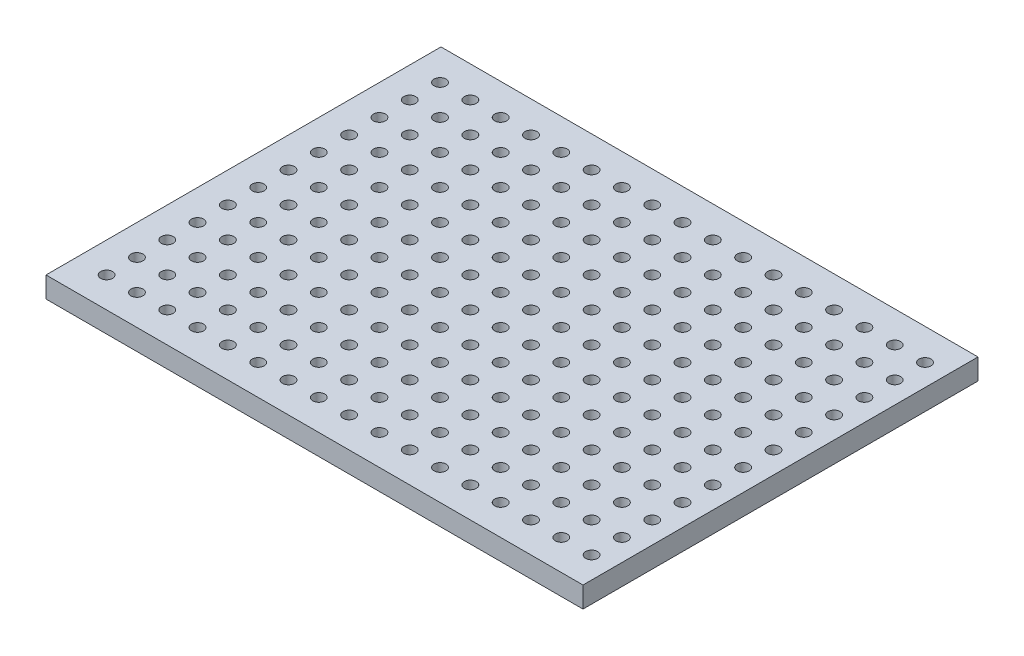
from build123d import *

# Parameters (mm, degrees)
SKETCH1_W            = 45
SKETCH1_H            = 33.1
BOSS_EXTRUDE1_DEPTH  = 0.875
SKETCH2_R            = 0.5
CUT_EXTRUDE1_DEPTH   = 28.985978632
LPATTERN1_COUNT      = 17
LPATTERN1_PITCH      = 2.54
LPATTERN1_COUNT_DIR2 = 12
LPATTERN1_PITCH_DIR2 = 2.54


with BuildPart() as part:
    # Sketch1 → Boss-Extrude1 (new, symmetric)
    with BuildSketch(Plane(origin=(0, 0, 0), x_dir=(1, 0, 0), z_dir=(0, 1, 0))):
        Rectangle(SKETCH1_W, SKETCH1_H)
    extrude(amount=BOSS_EXTRUDE1_DEPTH, both=True)

    # Sketch2 → Cut-Extrude1 (cut, through all)
    with BuildSketch(Plane(origin=(0, 0.875, 0), x_dir=(1, 0, 0), z_dir=(0, 1, 0))):
        with Locations((-19.96, -14.01)):
            Circle(SKETCH2_R)
    cut_extrude1 = extrude(amount=-CUT_EXTRUDE1_DEPTH, mode=Mode.SUBTRACT)

    # LPattern1: Cut-Extrude1 17 × 12
    with Locations(*[(i * LPATTERN1_PITCH, 0, -j * LPATTERN1_PITCH_DIR2) for i in range(LPATTERN1_COUNT) for j in range(LPATTERN1_COUNT_DIR2) if (i, j) != (0, 0)]):
        add(cut_extrude1, mode=Mode.SUBTRACT)


solid = part.part
